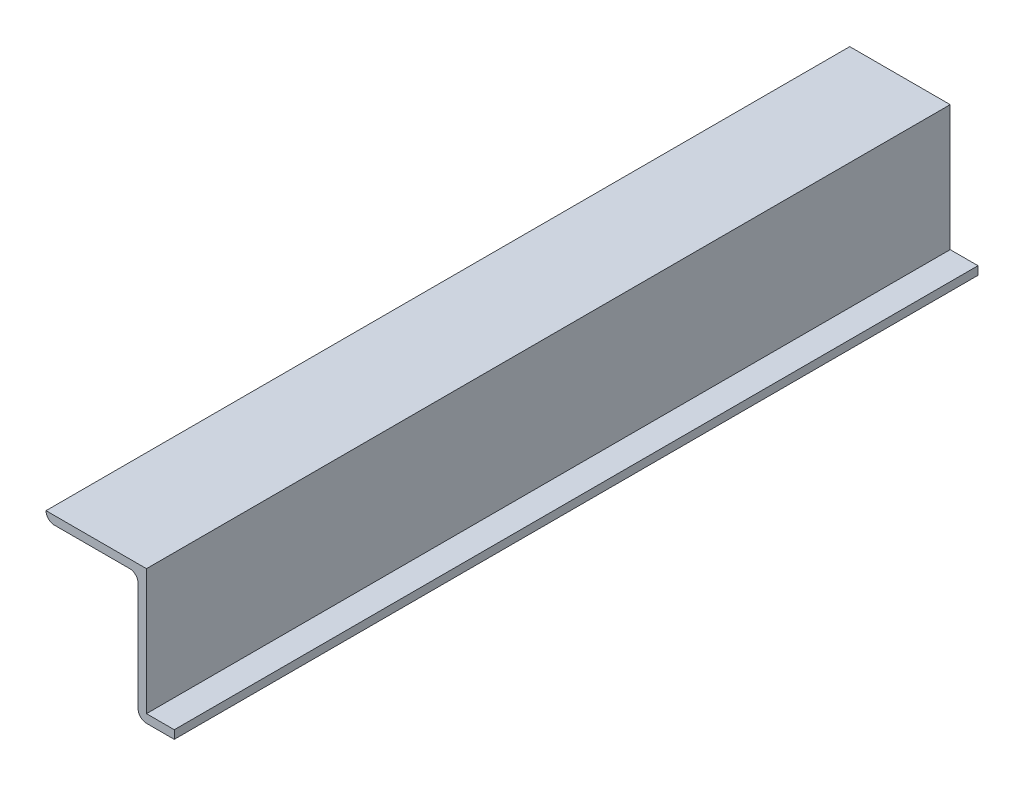
from build123d import *

# Parameters (mm, degrees)
BOSS_EXTRUDE1_DEPTH = 152.4
FILLET1_R           = 3.175


with BuildPart() as part:
    # Sketch3 → Boss-Extrude1 (new, symmetric)
    with BuildSketch(Plane.XY):
        Polygon((-34.925, 50.8), (3.175, 50.8), (3.175, 3.175), (13.716, 3.175), (13.716, 0), (0, 0), (0, 47.625), (-34.925, 47.625), align=None)
    extrude(amount=BOSS_EXTRUDE1_DEPTH, both=True)

    # Fillet1
    fillet1_edges = [part.edges().sort_by_distance(p)[0] for p in [
        (-34.925, 47.625, 0),
        (0, 47.625, 0),
        (0, 0, 0),
    ]]
    fillet(fillet1_edges, radius=FILLET1_R - 0.0001)  # a hair under: the kernel refuses the full size


solid = part.part
